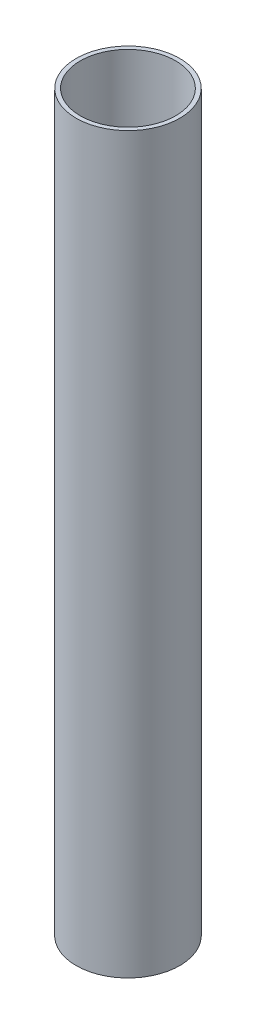
from build123d import *

# Parameters (mm, degrees)
SKETCH_1_R      = 25
SKETCH_1_R_2    = 23
EXTRUDE_1_DEPTH = 354


with BuildPart() as part:
    # Эскиз1 → Бобышка-Вытянуть1 (new body)
    with BuildSketch(Plane(origin=(0, 0, 0), x_dir=(1, 0, 0), z_dir=(0, 1, 0))):
        Circle(SKETCH_1_R)
        Circle(SKETCH_1_R_2, mode=Mode.SUBTRACT)
    extrude(amount=EXTRUDE_1_DEPTH)


solid = part.part
